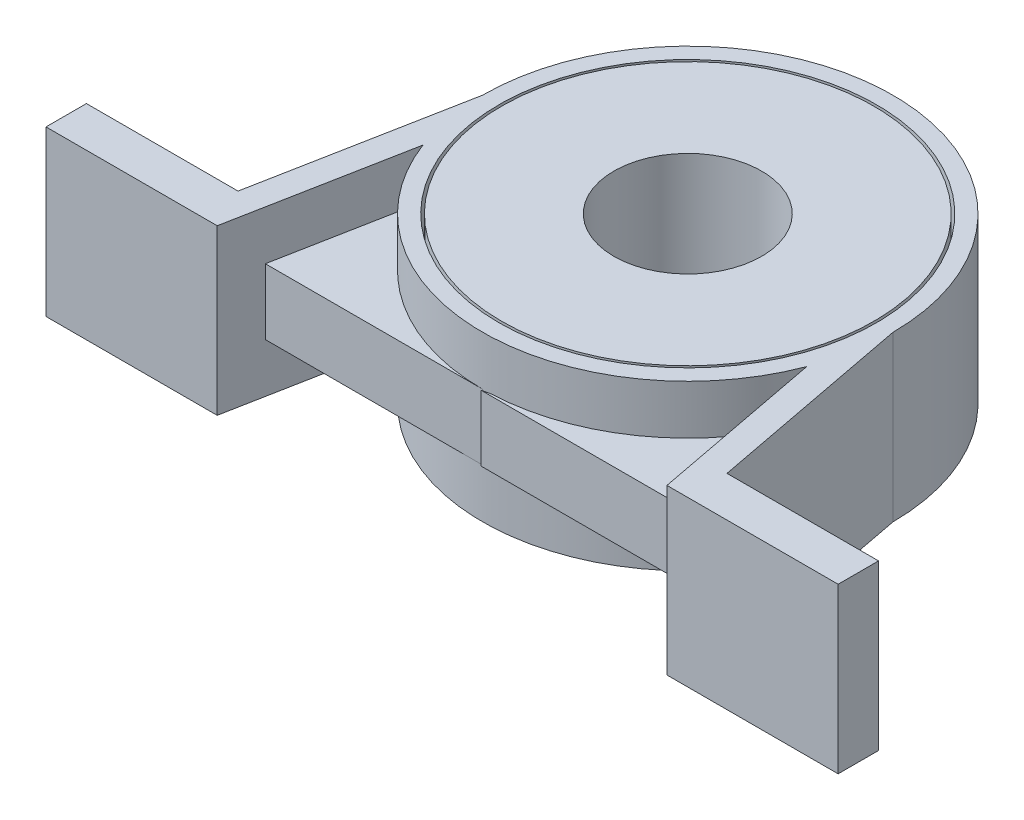
from build123d import *

# Parameters (mm, degrees)
BOSS_EXTRUDE1_DEPTH      = 5
BOSS_EXTRUDE1_DEPTH_BACK = 5
SKETCH1_R                = 11.5
BOSS_EXTRUDE2_START      = -2
BOSS_EXTRUDE2_DEPTH      = 4
BOSS_EXTRUDE3_DEPTH      = 2
BOSS_EXTRUDE3_DEPTH_BACK = 2
BOSS_EXTRUDE4_DEPTH      = 5
BOSS_EXTRUDE4_DEPTH_BACK = 5
SKETCH5_R                = 11.341581645
SKETCH5_R_2              = 10.881998828
BOSS_EXTRUDE5_DEPTH      = 5
BOSS_EXTRUDE5_DEPTH_BACK = 5
SKETCH6_R                = 10.881998828
SKETCH6_R_2              = 5
BOSS_EXTRUDE6_DEPTH      = 5
BOSS_EXTRUDE6_DEPTH_BACK = 8
SKETCH7_R                = 5
SKETCH7_R_2              = 4.5


# Read off the part's stored shape, not the designer's step: Boss-Extrude2
with BuildPart() as part:
    # Sketch1 → Boss-Extrude1 (new, two sides: drawn at the far end of the back side and taken through both)
    with BuildSketch(Plane(origin=(0, 0, 0), x_dir=(1, 0, 0), z_dir=(0, 1, 0)).offset(-BOSS_EXTRUDE1_DEPTH_BACK)):
        with BuildLine():
            Line((-12.5, 0), (-14.888075294, -12.5))
            Line((-14.888075294, -12.5), (-24.118681977, -12.5))
            Line((-24.118681977, -12.5), (-24.118681977, -14.962515671))
            Line((-24.118681977, -14.962515671), (-14.888075294, -14.962515671))
            Line((-14.888075294, -14.962515671), (-13.694037647, -14.962515671))
            Line((-13.694037647, -14.962515671), (-11.684129612, -4.441971995))
            ThreePointArc((-11.684129612, -4.441971995), (0, -12.5), (11.684129612, -4.441971995))
            Line((11.684129612, -4.441971995), (13.694037647, -14.962515671))
            Line((13.694037647, -14.962515671), (14.888075294, -14.962515671))
            Line((14.888075294, -14.962515671), (24.118681977, -14.962515671))
            Line((24.118681977, -14.962515671), (24.118681977, -12.5))
            Line((24.118681977, -12.5), (14.888075294, -12.5))
            Line((14.888075294, -12.5), (12.5, 0))
            ThreePointArc((12.5, 0), (0, 12.5), (-12.5, 0))
        make_face()
        with Locations(Location((0, 0, 0), (0, 0, 270))):
            Circle(SKETCH1_R, mode=Mode.SUBTRACT)
    extrude(amount=BOSS_EXTRUDE1_DEPTH + BOSS_EXTRUDE1_DEPTH_BACK)

    # Boss-Extrude2 outline → Boss-Extrude2 (add)
    with BuildSketch(Plane(origin=(0, 0, 0), x_dir=(1, 0, 0), z_dir=(0, 1, 0)).offset(BOSS_EXTRUDE2_START)):
        with BuildLine():
            ThreePointArc((11.545060202, -4.7918248), (7.158411272, -10.247299549), (0.526660373, -12.488900226))
            add(Edge.make_bspline(
                [(0.526660373, -12.488900226), (0.266171619, -12.548222015), (0, -12.604103366)],
                knots=[0.689319893, 0.689319893, 0.689319893, 0.709533534, 0.709533534, 0.709533534], degree=2))
            Line((0, -12.604103366), (13.243472354, -12.604103366))
            Line((13.243472354, -12.604103366), (11.684129612, -4.441971995))
            add(Edge.make_bspline(
                [(11.684129612, -4.441971995), (11.61743634, -4.618618616), (11.545060202, -4.7918248)],
                knots=[0, 0, 0, 0.020213641, 0.020213641, 0.020213641], degree=2))
        make_face()
    extrude(amount=BOSS_EXTRUDE2_DEPTH)

    # Sketch4 → Boss-Extrude3 (add, two sides: drawn at the far end of the back side and taken through both)
    with BuildSketch(Plane(origin=(0, 0, 0), x_dir=(1, 0, 0), z_dir=(0, 1, 0)).offset(-BOSS_EXTRUDE3_DEPTH_BACK)):
        with BuildLine():
            Line((0, -12.5), (-13.22358382, -12.5))
            Line((-13.22358382, -12.5), (-11.684129612, -4.441971995))
            add(Edge.make_bspline(
                [(0, -12.5), (-9.420476938, -10.800220507), (-11.684129612, -4.441971995)],
                knots=[0, 0, 0, 0.791193812, 0.791193812, 0.791193812], degree=2))
        make_face()
    extrude(amount=BOSS_EXTRUDE3_DEPTH + BOSS_EXTRUDE3_DEPTH_BACK)


with BuildPart() as body_2:
    # Sketch5 → Boss-Extrude4 (new, two sides: drawn at the far end of the back side and taken through both)
    with BuildSketch(Plane(origin=(0, 0, 0), x_dir=(1, 0, 0), z_dir=(0, 1, 0)).offset(-BOSS_EXTRUDE4_DEPTH_BACK)):
        with Locations(Location((0, 0, 0), (0, 0, 270))):
            Circle(SKETCH5_R)
        with Locations(Location((0, 0, 0), (0, 0, 270))):
            Circle(SKETCH5_R_2, mode=Mode.SUBTRACT)
    extrude(amount=BOSS_EXTRUDE4_DEPTH + BOSS_EXTRUDE4_DEPTH_BACK)



with BuildPart() as body_3:
    # Sketch6 → Boss-Extrude5 (new, two sides: drawn at the far end of the back side and taken through both)
    with BuildSketch(Plane(origin=(0, 0, 0), x_dir=(1, 0, 0), z_dir=(0, 1, 0)).offset(-BOSS_EXTRUDE5_DEPTH_BACK)):
        with Locations(Location((0, 0, 0), (0, 0, 270))):
            Circle(SKETCH6_R)
        with Locations(Location((0, 0, 0), (0, 0, 270))):
            Circle(SKETCH6_R_2, mode=Mode.SUBTRACT)
    extrude(amount=BOSS_EXTRUDE5_DEPTH + BOSS_EXTRUDE5_DEPTH_BACK)


with BuildPart() as body_2_1:
    add(body_2.part)

    add(body_3.part)  # Boss-Extrude6 merges body 3
    # Sketch7 → Boss-Extrude6 (add, two sides: drawn at the far end of the back side and taken through both)
    with BuildSketch(Plane(origin=(0, 0, 0), x_dir=(1, 0, 0), z_dir=(0, 1, 0)).offset(-BOSS_EXTRUDE6_DEPTH_BACK)):
        with Locations(Location((0, 0, 0), (0, 0, 270))):
            Circle(SKETCH7_R)
        with Locations(Location((0, 0, 0), (0, 0, 270))):
            Circle(SKETCH7_R_2, mode=Mode.SUBTRACT)
    extrude(amount=BOSS_EXTRUDE6_DEPTH + BOSS_EXTRUDE6_DEPTH_BACK)


solid = Compound([part.part, body_2_1.part])
